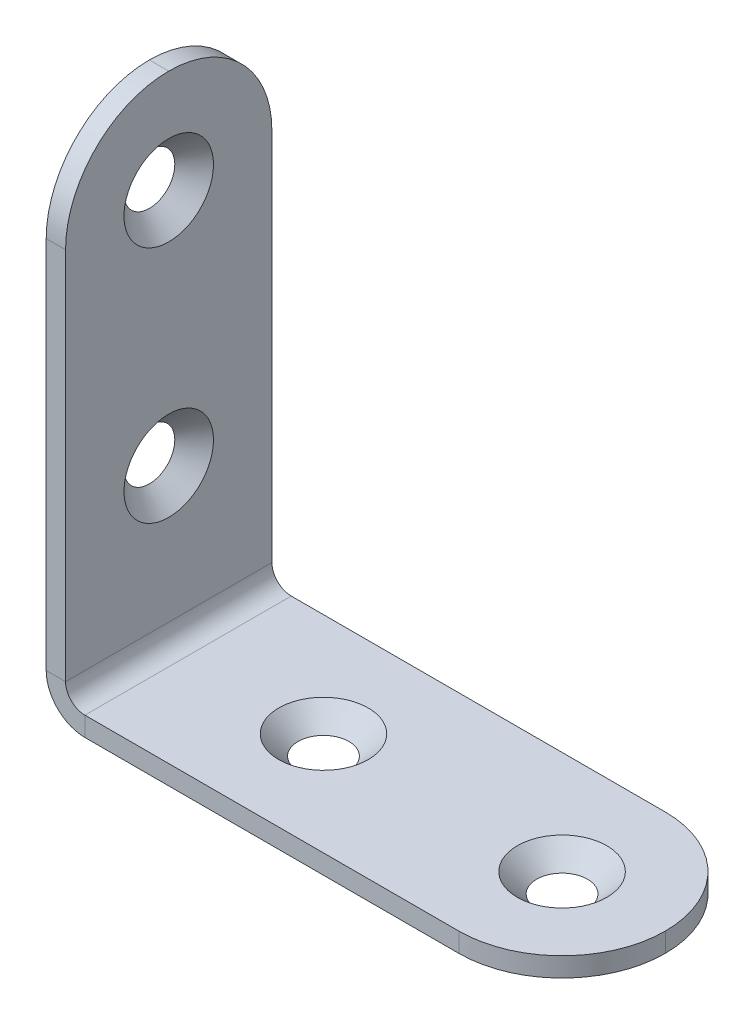
from build123d import *

# Parameters (mm, degrees)
BASE_FLANGIA1_DEPTH    = 16
RACCORDO1_R            = 8
RIPETIZIONE_A_L1_COUNT = 2
RIPETIZIONE_A_L1_PITCH = 18.5
RIPETIZIONE_A_L2_COUNT = 2
RIPETIZIONE_A_L2_PITCH = 18.5


# Sheet-metal steps are written as plain solids
with BuildPart() as part:
    # Schizzo1 → Base-Flangia1 (new body)
    with BuildSketch(Plane.XY):
        with BuildLine():
            Line((40, 0), (3, 0))
            ThreePointArc((3, 0), (0.878679656, 0.878679656), (0, 3))
            Line((0, 3), (0, 40))
            Line((0, 40), (1.5, 40))
            Line((1.5, 40), (1.5, 3))
            ThreePointArc((1.5, 3), (1.939339828, 1.939339828), (3, 1.5))
            Line((3, 1.5), (40, 1.5))
            Line((40, 1.5), (40, 0))
        make_face()
    extrude(amount=BASE_FLANGIA1_DEPTH)

    # Raccordo1
    raccordo1_edges = [part.edges().sort_by_distance(p)[0] for p in [
        (40, 0.75, 16),
        (40, 0.75, 0),
        (0.75, 40, 0),
        (0.75, 40, 16),
    ]]
    fillet(raccordo1_edges, radius=RACCORDO1_R - 0.0001)  # a hair under: the kernel refuses the full size

    # Schizzo7 → Foro svasato per Vite M3 a testa svasata (revolve, cut)
    with BuildSketch(Plane(origin=(32, 1.5, 8), x_dir=(0, 0, 1), z_dir=(1, 0, 0))):
        Polygon((0, 0), (0, 1.5), (1.7, 1.5), (1.7, 1.77), (3.47, 0), align=None)
    foro_svasato_per_vite_m3_a_testa_svasata = revolve(axis=Axis((32, 7.85, 8), (0, -1, 0)), mode=Mode.SUBTRACT)

    # Ripetizione a L1: Foro svasato per Vite M3 a testa svasata ×2
    with Locations(*[(-i * RIPETIZIONE_A_L1_PITCH, 0, 0) for i in range(1, RIPETIZIONE_A_L1_COUNT)]):
        add(foro_svasato_per_vite_m3_a_testa_svasata, mode=Mode.SUBTRACT)

    # Schizzo9 → Foro svasato per Vite M3 a testa sva 2 (revolve, cut)
    with BuildSketch(Plane(origin=(1.5, 32, 8), x_dir=(0, 0, -1), z_dir=(0, 1, 0))):
        Polygon((0, 0), (0, 1.5), (1.7, 1.5), (1.7, 1.77), (3.47, 0), align=None)
    foro_svasato_per_vite_m3_a_testa_sva_2 = revolve(axis=Axis((7.85, 32, 8), (-1, 0, 0)), mode=Mode.SUBTRACT)

    # Ripetizione a L2: Foro svasato per Vite M3 a testa sva 2 ×2
    with Locations(*[(0, -i * RIPETIZIONE_A_L2_PITCH, 0) for i in range(1, RIPETIZIONE_A_L2_COUNT)]):
        add(foro_svasato_per_vite_m3_a_testa_sva_2, mode=Mode.SUBTRACT)


solid = part.part
